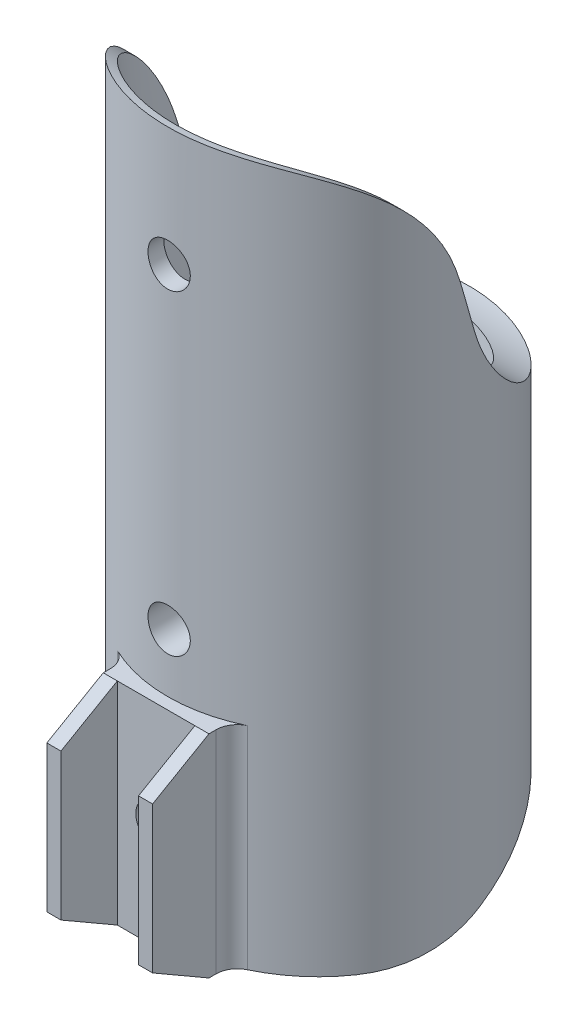
from build123d import *
from OCP.BRepFilletAPI import BRepFilletAPI_MakeChamfer
from build123d.topology import SkipClean

# Parameters (mm, degrees)
SKETCH2_R                    = 21.36
SKETCH2_R_2                  = 17.36
BOSS_EXTRUDE1_DEPTH          = 70
CUT_EXTRUDE1_DEPTH           = 77.239748163
CUT_EXTRUDE1_DEPTH_BACK      = 77.239748163
BOSS_EXTRUDE2_START          = 30
SKETCH4_R                    = 21.36
BOSS_EXTRUDE2_DEPTH          = 30
CUT_EXTRUDE2_DEPTH           = 177.999860139
CUT_EXTRUDE2_DEPTH_BACK      = 177.999860139
BOSS_EXTRUDE5_START          = -2.5
SKETCH6_W                    = 15
SKETCH6_H                    = 30
BOSS_EXTRUDE5_DEPTH          = 5
CUT_EXTRUDE3_REACH           = 87.581
CUT_EXTRUDE3_END_RADIUS      = 17.36
SKETCH7_R                    = 2.88
SKETCH8_W                    = 2
SKETCH8_H                    = 30
BOSS_EXTRUDE6_DEPTH          = 8
CHAMFER1_SIZE                = 4.618802154
CHAMFER1_SIZE_2              = 8
FILLET1_START                = -30
FILLET1_DEPTH                = 30
SKETCH13_R                   = 21.36
BOSS_EXTRUDE7_DEPTH          = 40
CUT_EXTRUDE4_START           = -25
SKETCH12_R                   = 16.36
CUT_EXTRUDE4_DEPTH           = 65
CUT_EXTRUDE4_DRAFT           = 4
F_6_0_6_DIAMETER_HOLE1_D     = 6
F_6_0_6_DIAMETER_HOLE1_DEPTH = 10
F_6_0_6_DIAMETER_HOLE1_TIP   = 1.802581857


with BuildPart() as part:
    # Sketch2 → Boss-Extrude1 (new body)
    with BuildSketch(Plane(origin=(0, 0, 0), x_dir=(1, 0, 0), z_dir=(0, 1, 0))):
        with Locations(Location((0, 0, 0), (0, 0, 270))):
            Circle(SKETCH2_R)
        with Locations(Location((0, 0, 0), (0, 0, 270))):
            Circle(SKETCH2_R_2, mode=Mode.SUBTRACT)
    extrude(amount=BOSS_EXTRUDE1_DEPTH)

    # Sketch3 → Cut-Extrude1 (cut, two sides: drawn at the far end of the back side and taken through both)
    with BuildSketch(Plane(origin=(0, 0, 0), x_dir=(0, 0, -1), z_dir=(1, 0, 0)).offset(-CUT_EXTRUDE1_DEPTH_BACK)):
        with BuildLine():
            Line((-21.36, 70), (21.36, 70))
            Line((21.36, 70), (21.36, 29.127615638))
            ThreePointArc((21.36, 29.127615638), (8.447671895, 33.457696671), (0.756475055, 44.697060978))
            Line((0.756475055, 44.697060978), (-1.21243639, 51.633979564))
            ThreePointArc((-1.21243639, 51.633979564), (-8.670118034, 63.686857241), (-21.36, 70))
        make_face()
    extrude(amount=CUT_EXTRUDE1_DEPTH + CUT_EXTRUDE1_DEPTH_BACK, mode=Mode.SUBTRACT)

    # Sketch4 → Boss-Extrude2 (add)
    with BuildSketch(Plane.XZ.offset(BOSS_EXTRUDE2_START)):
        with Locations(Location((0, 0, 0), (0, 0, 270))):
            Circle(SKETCH4_R)
        with BuildLine():
            Line((-4.972452925, -16.632627932), (-5.69639982, -18.502989734))
            ThreePointArc((-5.69639982, -18.502989734), (0, -19.36), (5.69639982, -18.502989734))
            Line((5.69639982, -18.502989734), (4.972452925, -16.632627932))
            ThreePointArc((4.972452925, -16.632627932), (15.03420101, -8.68), (16.890504783, 4.010043414))
            Line((16.890504783, 4.010043414), (18.872259065, 4.318267913))
            ThreePointArc((18.872259065, 4.318267913), (16.766251817, 9.68), (13.175859246, 14.184721821))
            Line((13.175859246, 14.184721821), (11.918051858, 12.622584518))
            ThreePointArc((11.918051858, 12.622584518), (0, 17.36), (-11.918051858, 12.622584518))
            Line((-11.918051858, 12.622584518), (-13.175859246, 14.184721821))
            ThreePointArc((-13.175859246, 14.184721821), (-16.766251817, 9.68), (-18.872259065, 4.318267913))
            Line((-18.872259065, 4.318267913), (-16.890504783, 4.010043414))
            ThreePointArc((-16.890504783, 4.010043414), (-15.03420101, -8.68), (-4.972452925, -16.632627932))
        make_face(mode=Mode.SUBTRACT)
    extrude(amount=-BOSS_EXTRUDE2_DEPTH)

    # Sketch5 → Cut-Extrude2 (cut, two sides: drawn at the far end of the back side and taken through both)
    with BuildSketch(Plane(origin=(0, -104.403128543, 0), x_dir=(0, 0, -1), z_dir=(1, 0, 0)).offset(-CUT_EXTRUDE2_DEPTH_BACK)):
        with BuildLine():
            Line((16.115208657, 85.337435095), (1.704786801, 77.811344328))
            ThreePointArc((1.704786801, 77.811344328), (-5.033178535, 75.267638789), (-12.183230057, 74.403128543))
            Line((-12.183230057, 74.403128543), (21.36, 74.403128543))
            Line((21.36, 74.403128543), (21.36, 85.337435095))
            Line((21.36, 85.337435095), (21.36, 92.800817822))
            Line((21.36, 92.800817822), (16.115208657, 92.800817822))
            Line((16.115208657, 92.800817822), (16.115208657, 85.337435095))
        make_face()
    extrude(amount=CUT_EXTRUDE2_DEPTH + CUT_EXTRUDE2_DEPTH_BACK, mode=Mode.SUBTRACT)

    # Sketch6 → Boss-Extrude5 (add)
    with SkipClean():  # the faces are left unmerged after this step: merging them gives an invalid solid
        with BuildSketch(Plane.XY.offset(25.5).offset(BOSS_EXTRUDE5_START)):
            with Locations((0, -15)):
                Rectangle(SKETCH6_W, SKETCH6_H)
        extrude(amount=-BOSS_EXTRUDE5_DEPTH)

    # Cut-Extrude3: up to this cylinder (the profile starts outside it)
    with SkipClean():  # the faces are left unmerged after this step: merging them gives an invalid solid
        cut_extrude3_end = Plane(origin=(0, -14.968063, 0), z_dir=(0, -1, 0)) * Cylinder(CUT_EXTRUDE3_END_RADIUS, 210.882, mode=Mode.PRIVATE)
        # Sketch7 → Cut-Extrude3 (cut, up to the surface)
        with BuildSketch(Plane.XY.offset(23), mode=Mode.PRIVATE) as cut_extrude3_sk1:
            with Locations((0, -14.968063303)):
                Circle(SKETCH7_R)
        cut_extrude3_tool1 = extrude(cut_extrude3_sk1.sketch, amount=-CUT_EXTRUDE3_REACH, mode=Mode.PRIVATE) - cut_extrude3_end
        add(cut_extrude3_tool1.solids().sort_by_distance((0, -14.968063, 23))[0], mode=Mode.SUBTRACT)

    # Sketch8 → Boss-Extrude6 (add)
    with SkipClean():  # the faces are left unmerged after this step: merging them gives an invalid solid
        with BuildSketch(Plane.XY.offset(23)):
            with Locations((-6.5, -15)):
                Rectangle(SKETCH8_W, SKETCH8_H)
            with Locations((6.5, -15)):
                Rectangle(SKETCH8_W, SKETCH8_H)
        extrude(amount=BOSS_EXTRUDE6_DEPTH)

    # Chamfer1
    chamfer1_edges_1 = [part.edges().sort_by_distance(p)[0] for p in [
        (6.5, -30, 31),
    ]]
    chamfer1_side_1 = [part.faces().sort_by_distance(p)[0] for p in [
        (6.5, -29.907623957, 31),
    ]]
    chamfer1_edges_2 = [part.edges().sort_by_distance(p)[0] for p in [
        (-6.5, -30, 31),
    ]]
    chamfer1_side_2 = [part.faces().sort_by_distance(p)[0] for p in [
        (-6.5, -29.907623957, 31),
    ]]
    chamfer1_edges_3 = [part.edges().sort_by_distance(p)[0] for p in [
        (-6.5, 0, 31),
    ]]
    chamfer1_side_3 = [part.faces().sort_by_distance(p)[0] for p in [
        (-6.5, 0, 30.907623957),
    ]]
    chamfer1_edges_4 = [part.edges().sort_by_distance(p)[0] for p in [
        (6.5, 0, 31),
    ]]
    chamfer1_side_4 = [part.faces().sort_by_distance(p)[0] for p in [
        (6.5, 0, 30.907623957),
    ]]
    chamfer1 = BRepFilletAPI_MakeChamfer(part.part.solid().wrapped)
    for e in chamfer1_edges_1:
        chamfer1.Add(CHAMFER1_SIZE - 0.0001, CHAMFER1_SIZE_2 - 0.0001, e.wrapped, chamfer1_side_1[0].wrapped)
    for e in chamfer1_edges_2:
        chamfer1.Add(CHAMFER1_SIZE - 0.0001, CHAMFER1_SIZE_2 - 0.0001, e.wrapped, chamfer1_side_2[0].wrapped)
    for e in chamfer1_edges_3:
        chamfer1.Add(CHAMFER1_SIZE_2 - 0.0001, CHAMFER1_SIZE - 0.0001, e.wrapped, chamfer1_side_3[0].wrapped)
    for e in chamfer1_edges_4:
        chamfer1.Add(CHAMFER1_SIZE_2 - 0.0001, CHAMFER1_SIZE - 0.0001, e.wrapped, chamfer1_side_4[0].wrapped)
    add(Compound.cast(chamfer1.Shape()), mode=Mode.REPLACE)  # a hair under: the kernel refuses the full size

    # Fillet1: read off the stored shape, not the designer's step
    # Fillet1 outline → Fillet1 (add)
    with BuildSketch(Plane(origin=(0, 0, 0), x_dir=(1, 0, 0), z_dir=(0, 1, 0)).offset(FILLET1_START)):
        with BuildLine():
            ThreePointArc((-7.5, -19.99999), (-8.36133393, -19.655474935), (-9.206896552, -19.273885334))
            ThreePointArc((-9.206896552, -19.273885334), (-7.962352433, -20.380783947), (-7.5, -21.980891702))
            Line((-7.5, -21.980891702), (-7.5, -19.99999))
        make_face()
        with BuildLine():
            ThreePointArc((7.5, -21.980891702), (7.962352433, -20.380783947), (9.206896552, -19.273885334))
            ThreePointArc((9.206896552, -19.273885334), (8.36133393, -19.655474935), (7.5, -19.99999))
            Line((7.5, -19.99999), (7.5, -21.980891702))
        make_face()
    extrude(amount=FILLET1_DEPTH)

    # Sketch13 → Boss-Extrude7 (add)
    with BuildSketch(Plane.XZ.offset(11.602310721)):
        with Locations(Location((0, 0, 0), (0, 0, 311.022024605))):
            Circle(SKETCH13_R)
        with BuildLine():
            Line((5.69639982, -18.502989734), (4.610293888, -15.69696755))
            ThreePointArc((4.610293888, -15.69696755), (14.168175606, -8.18), (15.899119605, 3.855852149))
            Line((15.899119605, 3.855852149), (18.872259065, 4.318267913))
            ThreePointArc((18.872259065, 4.318267913), (16.766251817, 9.68), (13.175859246, 14.184721821))
            Line((13.175859246, 14.184721821), (11.288825716, 11.841115401))
            ThreePointArc((11.288825716, 11.841115401), (0, 16.36), (-11.288825716, 11.841115401))
            Line((-11.288825716, 11.841115401), (-13.175859246, 14.184721821))
            ThreePointArc((-13.175859246, 14.184721821), (-16.766251817, 9.68), (-18.872259065, 4.318267913))
            Line((-18.872259065, 4.318267913), (-15.899119605, 3.855852149))
            ThreePointArc((-15.899119605, 3.855852149), (-14.168175606, -8.18), (-4.610293888, -15.69696755))
            Line((-4.610293888, -15.69696755), (-5.69639982, -18.502989734))
            ThreePointArc((-5.69639982, -18.502989734), (0, -19.36), (5.69639982, -18.502989734))
        make_face(mode=Mode.SUBTRACT)
    extrude(amount=-BOSS_EXTRUDE7_DEPTH)


with BuildPart() as cut_extrude4_tool:
    # Sketch12 → Cut-Extrude4 (with draft: the straight prism first)
    with BuildSketch(Plane.XZ.offset(11.602310721).offset(CUT_EXTRUDE4_START)):
        Circle(SKETCH12_R)
    extrude(amount=-CUT_EXTRUDE4_DEPTH)
    # Cut-Extrude4: the draft: its side faces are tilted about the plane it starts from
    cut_extrude4_sides = [cut_extrude4_tool.faces().sort_by_distance(p)[0] for p in [
        (-16.36, 45.897689279, 0),
    ]]
    draft(cut_extrude4_sides, Plane.XZ.offset(11.602310721).offset(CUT_EXTRUDE4_START), CUT_EXTRUDE4_DRAFT)


with BuildPart() as part_1:
    add(part.part)

    # Cut-Extrude4: cut by cut_extrude4_tool
    add(cut_extrude4_tool.part, mode=Mode.SUBTRACT)

    # Ø6.0 (6) Diameter Hole1
    with Locations(Plane.XY.offset(21.36)):
        with Locations((0, 53.07527143), (0, 8.258011489)):
            Hole(F_6_0_6_DIAMETER_HOLE1_D / 2, depth=F_6_0_6_DIAMETER_HOLE1_DEPTH)
            with Locations((0, 0, -(F_6_0_6_DIAMETER_HOLE1_DEPTH + F_6_0_6_DIAMETER_HOLE1_TIP / 2))):  # 118° drill point
                Cone(0, F_6_0_6_DIAMETER_HOLE1_D / 2, F_6_0_6_DIAMETER_HOLE1_TIP, mode=Mode.SUBTRACT)


solid = part_1.part
